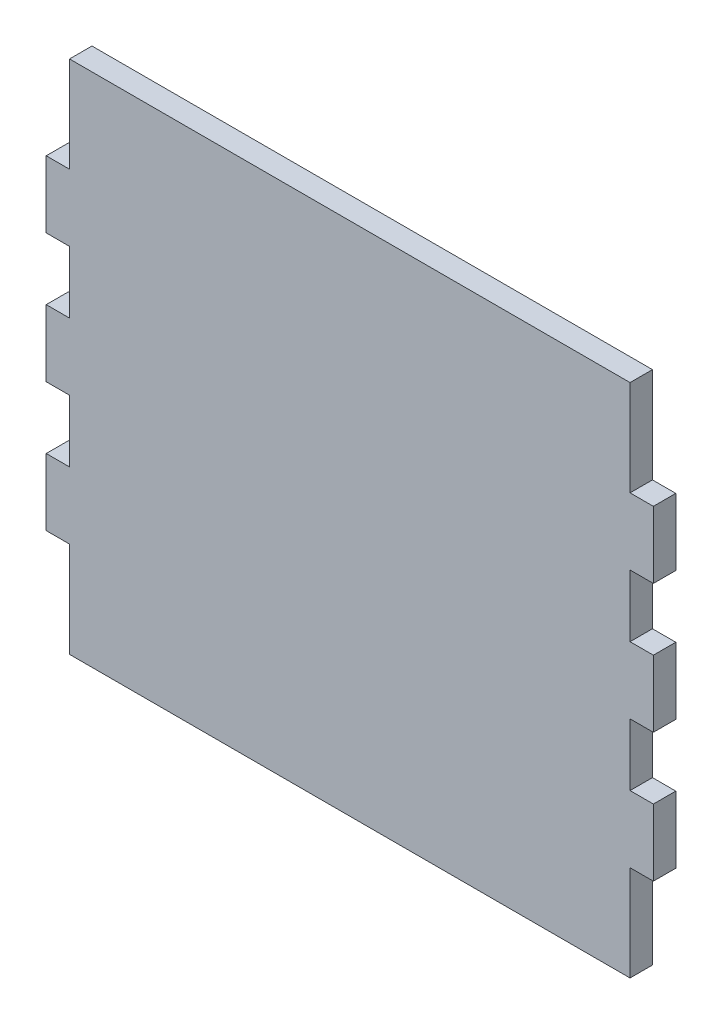
from build123d import *

# Parameters (mm, degrees)
BOSS_EXTRUDE1_DEPTH = 3.175


with BuildPart() as part:
    # Sketch1 → Boss-Extrude1 (new, symmetric)
    with BuildSketch(Plane.XY):
        Polygon((79.375, 73.025), (-79.375, 73.025), (-79.375, 45.974), (-85.979, 45.974), (-85.979, 27.051), (-79.375, 27.051), (-79.375, 9.4615), (-85.979, 9.4615), (-85.979, -9.4615), (-79.375, -9.4615), (-79.375, -27.051), (-85.979, -27.051), (-85.979, -45.974), (-79.375, -45.974), (-79.375, -73.025), (79.375, -73.025), (79.375, -45.974), (85.979, -45.974), (85.979, -27.051), (79.375, -27.051), (79.375, -9.4615), (85.979, -9.4615), (85.979, 9.4615), (79.375, 9.4615), (79.375, 27.051), (85.979, 27.051), (85.979, 45.974), (79.375, 45.974), align=None)
    extrude(amount=BOSS_EXTRUDE1_DEPTH, both=True)


solid = part.part
